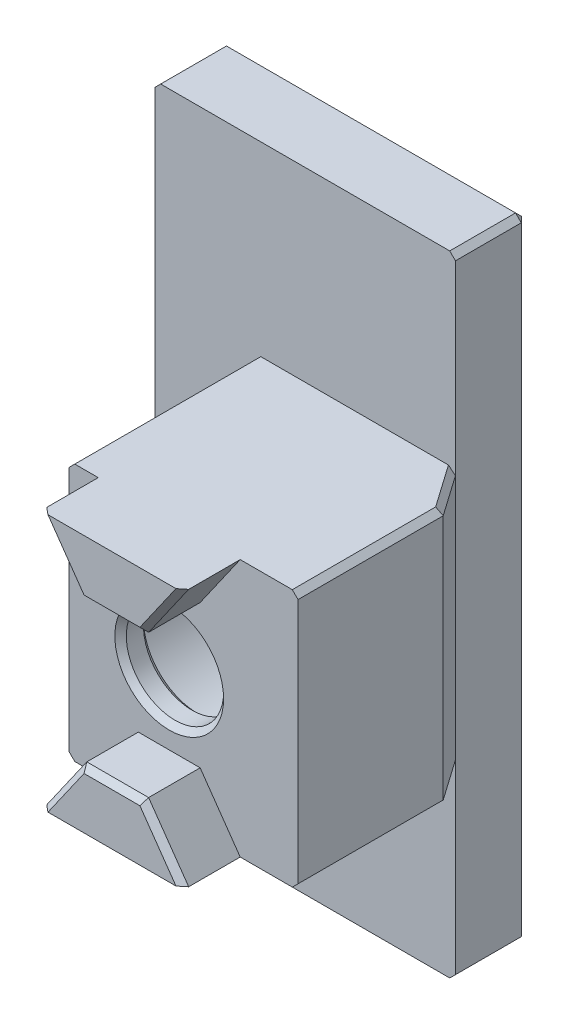
from build123d import *

# Parameters (mm, degrees)
BOSS_EXTRUDE1_DEPTH            = 4
SLOT_TAB_DEPTH                 = 2
CBORE_FOR_M3_SHCS2_D           = 3.4
CBORE_FOR_M3_SHCS2_CBORE_D     = 6.5
CBORE_FOR_M3_SHCS2_CBORE_DEPTH = 3
STOPPER_START                  = 2.5
SKETCH3_W                      = 8
SKETCH3_H                      = 9
SKETCH3_R                      = 3.25
STOPPER_CLEARANCE_DEPTH        = 2.5
SKETCH4_W                      = 10.5
SKETCH4_H                      = 22
SKETCH4_R                      = 3.25
STOPPER_DEPTH                  = 2.5
PRINT_CHAMFER_DEPTH            = 17.560495216
PRINT_CHAMFER_DEPTH_BACK       = 17.560495216
CHAMFER5_SIZE                  = 0.2


with BuildPart() as part:
    # Sketch1 → Boss-Extrude1 (new body)
    with BuildSketch(Plane.XY):
        Polygon((0.5, -4.5), (7.5, -4.5), (8.5, -4.5), (8.5, 4.5), (7.5, 4.5), (0.5, 4.5), align=None)
    extrude(amount=-BOSS_EXTRUDE1_DEPTH)

    # Sketch2 → Slot Tab (add)
    with BuildSketch(Plane.XY):
        Polygon((2.92028223, -2.5), (1.519867154, -4.5), (6.480132846, -4.5), (5.07971777, -2.5), align=None)
    slot_tab = extrude(amount=SLOT_TAB_DEPTH)

    # Slot Tabs: Slot Tab across plane
    add(slot_tab.mirror(Plane.ZX))

    # CBORE for M3 SHCS2 (through all)
    with Locations(Plane(origin=(0, 0, -4), x_dir=(-1, 0, 0), z_dir=(0, 0, -1))):
        with Locations((-4, 0)):
            CounterBoreHole(CBORE_FOR_M3_SHCS2_D / 2, CBORE_FOR_M3_SHCS2_CBORE_D / 2, CBORE_FOR_M3_SHCS2_CBORE_DEPTH)

    # Sketch3 → Stopper Clearance (add)
    with BuildSketch(Plane(origin=(0, 0, -4), x_dir=(-1, 0, 0), z_dir=(0, 0, -1)).offset(STOPPER_START)):
        with Locations((-4.5, 0)):
            Rectangle(SKETCH3_W, SKETCH3_H)
        with Locations((-4, 0)):
            Circle(SKETCH3_R, mode=Mode.SUBTRACT)
    extrude(amount=-STOPPER_CLEARANCE_DEPTH)

    # Sketch4 → Stopper (add)
    with BuildSketch(Plane(origin=(0, 0, -6.5), x_dir=(-1, 0, 0), z_dir=(0, 0, -1)).offset(STOPPER_START)):
        with Locations((-2.25, 0)):
            Rectangle(SKETCH4_W, SKETCH4_H)
        with Locations((-4, 0)):
            Circle(SKETCH4_R, mode=Mode.SUBTRACT)
    extrude(amount=-STOPPER_DEPTH)

    # Deburs With Stopper
    # the kernel refuses this chamfer: 0.2 mm, written as the material it takes off along each edge
    with BuildSketch(Plane(origin=(-2.866666667, -10.866666667, -8.866666667), x_dir=(-0.7071067811865491, 0, 0.707106781186546), z_dir=(-0.5773502691896235, -0.5773502691896274, -0.5773502691896262)), Plane(origin=(-2.866666667, 10.866666667, -8.866666667), x_dir=(1.5700924586837806e-15, 0.7071067811865476, 0.7071067811865476), z_dir=(-0.5773502691896244, 0.5773502691896271, -0.5773502691896257)), Plane(origin=(7.366666667, 10.866666667, -8.866666667), x_dir=(0.7071067811865491, 0, 0.707106781186546), z_dir=(0.5773502691896232, 0.5773502691896284, -0.5773502691896257))) as deburs_with_stopper_piece_1:
        Polygon((-0.141421356, 0.081649658), (0.141421356, 0.081649658), (0, -0.163299316), align=None)
    extrude(amount=0.254034118, mode=Mode.SUBTRACT)
    with BuildSketch(Plane(origin=(7.366666667, -10.866666667, -8.866666667), x_dir=(0.7071067811865491, 0, 0.707106781186546), z_dir=(0.5773502691896241, -0.5773502691896267, -0.5773502691896267))) as deburs_with_stopper_piece_2:
        Polygon((-0.141421356, -0.081649658), (0.141421356, -0.081649658), (0, 0.163299316), align=None)
    extrude(amount=0.254034118, mode=Mode.SUBTRACT)
    with BuildSketch(Plane(origin=(8.5, 4.5, -7.014336598), x_dir=(-0.9996219169112966, 0.02749587661058742, 0), z_dir=(0, 0, 1))) as deburs_with_stopper_piece_3:
        with BuildLine():
            Line((0.205734639, 0), (-0.011309431, 0.205423559))
            Line((-0.011309431, 0.205423559), (-0.015307919, 0.205313575))
            ThreePointArc((-0.015307919, 0.205313575), (-0.006825845, 0.102679566), (-0.003998488, -0.000109984))
            Line((-0.003998488, -0.000109984), (0.000109984, -0.003998488))
            ThreePointArc((0.000109984, -0.003998488), (0.102899533, -0.00117113), (0.205844623, -0.003998488))
            Line((0.205844623, -0.003998488), (0.205734639, 0))
        make_face()
    extrude(amount=7.528673195, mode=Mode.SUBTRACT)
    with BuildSketch(Plane(origin=(8.5, -4.5, -7.014336598), x_dir=(-0.9996219169112966, -0.02749587661058742, 0), z_dir=(0, 0, 1))) as deburs_with_stopper_piece_4:
        with BuildLine():
            Line((0.205734639, 0), (-0.011309431, -0.205423559))
            Line((-0.011309431, -0.205423559), (-0.015307919, -0.205313575))
            ThreePointArc((-0.015307919, -0.205313575), (-0.006825845, -0.102679566), (-0.003998488, 0.000109984))
            Line((-0.003998488, 0.000109984), (0.000109984, 0.003998488))
            ThreePointArc((0.000109984, 0.003998488), (0.102899533, 0.00117113), (0.205844623, 0.003998488))
            Line((0.205844623, 0.003998488), (0.205734639, 0))
        make_face()
    extrude(amount=7.528673195, mode=Mode.SUBTRACT)
    with BuildSketch(Plane(origin=(0.5, -4.5, 0.514336598), x_dir=(0.9996219169112966, -0.02749587661058736, 0), z_dir=(0, 0, -1))) as deburs_with_stopper_piece_5:
        with BuildLine():
            Line((0.205734639, 0), (-0.011309431, -0.205423559))
            Line((-0.011309431, -0.205423559), (-0.015307919, -0.205313575))
            ThreePointArc((-0.015307919, -0.205313575), (-0.006825845, -0.102679566), (-0.003998488, 0.000109984))
            Line((-0.003998488, 0.000109984), (0.000109984, 0.003998488))
            ThreePointArc((0.000109984, 0.003998488), (0.102899533, 0.00117113), (0.205844623, 0.003998488))
            Line((0.205844623, 0.003998488), (0.205734639, 0))
        make_face()
    extrude(amount=7.014336598, mode=Mode.SUBTRACT)
    with BuildSketch(Plane(origin=(0.5, 4.5, 0.514336598), x_dir=(0.9996219169112966, 0.02749587661058733, 0), z_dir=(0, 0, -1))) as deburs_with_stopper_piece_6:
        with BuildLine():
            Line((0.205734639, 0), (-0.011309431, 0.205423559))
            Line((-0.011309431, 0.205423559), (-0.015307919, 0.205313575))
            ThreePointArc((-0.015307919, 0.205313575), (-0.006825845, 0.102679566), (-0.003998488, -0.000109984))
            Line((-0.003998488, -0.000109984), (0.000109984, -0.003998488))
            ThreePointArc((0.000109984, -0.003998488), (0.102899533, -0.00117113), (0.205844623, -0.003998488))
            Line((0.205844623, -0.003998488), (0.205734639, 0))
        make_face()
    extrude(amount=7.014336598, mode=Mode.SUBTRACT)
    with BuildSketch(Plane(origin=(6.775144199, -4.921319875, 2), x_dir=(-0.8188423367539712, -0.5733595768003803, 0.02749587661058727), z_dir=(-0.5735764363510434, 0.8191520442889937, 0)), Plane(origin=(3.215293583, 2.078680125, 2), x_dir=(-0.02252330353507913, -0.015770986920647746, -0.9996219169112968), z_dir=(-0.5735764363510445, 0.8191520442889929, 0))) as deburs_with_stopper_piece_7:
        with BuildLine():
            Line((0.205734639, 0), (-0.011309431, -0.205423559))
            Line((-0.011309431, -0.205423559), (-0.015307919, -0.205313575))
            ThreePointArc((-0.015307919, -0.205313575), (-0.006825845, -0.102679566), (-0.003998488, 0.000109984))
            Line((-0.003998488, 0.000109984), (0.000109984, 0.003998488))
            ThreePointArc((0.000109984, 0.003998488), (0.102899533, 0.00117113), (0.205844623, 0.003998488))
            Line((0.205844623, 0.003998488), (0.205734639, 0))
        make_face()
    extrude(amount=3.470222373, mode=Mode.SUBTRACT)
    with BuildSketch(Plane(origin=(5.594054367, -2.5, 2), x_dir=(0, 0.02749587661058736, -0.9996219169112966), z_dir=(-1, 0, 0)), Plane(origin=(5.594054367, 2.5, 2), x_dir=(0, 0.9996219169112966, 0.027495876610587302), z_dir=(-1, 0, 0))) as deburs_with_stopper_piece_8:
        with BuildLine():
            Line((0.205734639, 0), (-0.011309431, 0.205423559))
            Line((-0.011309431, 0.205423559), (-0.015307919, 0.205313575))
            ThreePointArc((-0.015307919, 0.205313575), (-0.006825845, 0.102679566), (-0.003998488, -0.000109984))
            Line((-0.003998488, -0.000109984), (0.000109984, -0.003998488))
            ThreePointArc((0.000109984, -0.003998488), (0.102899533, -0.00117113), (0.205844623, -0.003998488))
            Line((0.205844623, -0.003998488), (0.205734639, 0))
        make_face()
    extrude(amount=3.188108734, mode=Mode.SUBTRACT)
    with BuildSketch(Plane(origin=(3.215293583, -2.078680125, 2), x_dir=(-0.02252330353507913, 0.015770986920647746, -0.9996219169112968), z_dir=(-0.5735764363510445, -0.8191520442889929, 0)), Plane(origin=(6.775144199, 4.921319875, 2), x_dir=(-0.8188423367539712, 0.5733595768003803, 0.02749587661058727), z_dir=(-0.5735764363510434, -0.8191520442889937, 0))) as deburs_with_stopper_piece_9:
        with BuildLine():
            Line((0.205734639, 0), (-0.011309431, 0.205423559))
            Line((-0.011309431, 0.205423559), (-0.015307919, 0.205313575))
            ThreePointArc((-0.015307919, 0.205313575), (-0.006825845, 0.102679566), (-0.003998488, -0.000109984))
            Line((-0.003998488, -0.000109984), (0.000109984, -0.003998488))
            ThreePointArc((0.000109984, -0.003998488), (0.102899533, -0.00117113), (0.205844623, -0.003998488))
            Line((0.205844623, -0.003998488), (0.205734639, 0))
        make_face()
    extrude(amount=3.470222373, mode=Mode.SUBTRACT)
    with BuildSketch(Plane(origin=(4, 0, 0), x_dir=(1, 0, 0), z_dir=(0, -1, 0))) as deburs_with_stopper_piece_10:
        with BuildLine():
            Line((1.905656854, 0.005656854), (1.694343146, -0.205656854))
            Line((1.694343146, -0.205656854), (1.690343146, -0.205656854))
            ThreePointArc((1.690343146, -0.205656854), (1.696, -0.102828427), (1.696, 0))
            Line((1.696, 0), (1.7, 0.004))
            ThreePointArc((1.7, 0.004), (1.802828427, 0.004), (1.905656854, 0.009656854))
            Line((1.905656854, 0.009656854), (1.905656854, 0.005656854))
        make_face()
    revolve(axis=Axis((4, 0, 0), (0, 0, 1)), mode=Mode.SUBTRACT)
    with BuildSketch(Plane(origin=(4, 0, -1), x_dir=(1, 0, 0), z_dir=(0, -1, 0))) as deburs_with_stopper_piece_11:
        with BuildLine():
            Line((1.694343146, 0.205656854), (1.905656854, -0.005656854))
            Line((1.905656854, -0.005656854), (1.905656854, -0.009656854))
            ThreePointArc((1.905656854, -0.009656854), (1.802828427, -0.004), (1.7, -0.004))
            Line((1.7, -0.004), (1.696, 0))
            ThreePointArc((1.696, 0), (1.696, 0.102828427), (1.690343146, 0.205656854))
            Line((1.690343146, 0.205656854), (1.694343146, 0.205656854))
        make_face()
    revolve(axis=Axis((4, 0, -1), (0, 0, 1)), mode=Mode.SUBTRACT)
    with BuildSketch(Plane(origin=(-3, -11.514336598, -9), x_dir=(0.9996219169112966, 0, -0.027495876610587302), z_dir=(0, 1, 0)), Plane(origin=(7.5, 11.514336598, -9), x_dir=(-0.9996219169112966, 0, -0.02749587661058742), z_dir=(0, -1, 0))) as deburs_with_stopper_piece_12:
        with BuildLine():
            Line((0.205734639, 0), (-0.011309431, -0.205423559))
            Line((-0.011309431, -0.205423559), (-0.015307919, -0.205313575))
            ThreePointArc((-0.015307919, -0.205313575), (-0.006825845, -0.102679566), (-0.003998488, 0.000109984))
            Line((-0.003998488, 0.000109984), (0.000109984, 0.003998488))
            ThreePointArc((0.000109984, 0.003998488), (0.102899533, 0.00117113), (0.205844623, 0.003998488))
            Line((0.205844623, 0.003998488), (0.205734639, 0))
        make_face()
    extrude(amount=23.028673195, mode=Mode.SUBTRACT)
    with BuildSketch(Plane(origin=(-3.514336598, 11, -9), x_dir=(0, -0.9996219169112966, -0.02749587661058742), z_dir=(1, 0, 0)), Plane(origin=(8.014336598, -11, -9), x_dir=(0, 0.9996219169112966, -0.02749587661058742), z_dir=(-1, 0, 0))) as deburs_with_stopper_piece_13:
        with BuildLine():
            Line((0.205734639, 0), (-0.011309431, -0.205423559))
            Line((-0.011309431, -0.205423559), (-0.015307919, -0.205313575))
            ThreePointArc((-0.015307919, -0.205313575), (-0.006825845, -0.102679566), (-0.003998488, 0.000109984))
            Line((-0.003998488, 0.000109984), (0.000109984, 0.003998488))
            ThreePointArc((0.000109984, 0.003998488), (0.102899533, 0.00117113), (0.205844623, 0.003998488))
            Line((0.205844623, 0.003998488), (0.205734639, 0))
        make_face()
    extrude(amount=11.528673195, mode=Mode.SUBTRACT)
    with BuildSketch(Plane(origin=(-3, -11, -9.514336598), x_dir=(-0.02749587661058742, 0.9996219169112966, 0), z_dir=(0, 0, 1)), Plane(origin=(-3, 11, -9.514336598), x_dir=(0.9996219169112966, 0.027495876610587302, 0), z_dir=(0, 0, 1)), Plane(origin=(7.5, 11, -9.514336598), x_dir=(0.02749587661058742, -0.9996219169112966, 0), z_dir=(0, 0, 1))) as deburs_with_stopper_piece_14:
        with BuildLine():
            Line((0.205734639, 0), (-0.011309431, -0.205423559))
            Line((-0.011309431, -0.205423559), (-0.015307919, -0.205313575))
            ThreePointArc((-0.015307919, -0.205313575), (-0.006825845, -0.102679566), (-0.003998488, 0.000109984))
            Line((-0.003998488, 0.000109984), (0.000109984, 0.003998488))
            ThreePointArc((0.000109984, 0.003998488), (0.102899533, 0.00117113), (0.205844623, 0.003998488))
            Line((0.205844623, 0.003998488), (0.205734639, 0))
        make_face()
    extrude(amount=3.528673195, mode=Mode.SUBTRACT)
    with BuildSketch(Plane(origin=(7.5, -11, -9.514336598), x_dir=(0.02749587661058742, 0.9996219169112966, 0), z_dir=(0, 0, 1))) as deburs_with_stopper_piece_15:
        with BuildLine():
            Line((0.205734639, 0), (-0.011309431, 0.205423559))
            Line((-0.011309431, 0.205423559), (-0.015307919, 0.205313575))
            ThreePointArc((-0.015307919, 0.205313575), (-0.006825845, 0.102679566), (-0.003998488, -0.000109984))
            Line((-0.003998488, -0.000109984), (0.000109984, -0.003998488))
            ThreePointArc((0.000109984, -0.003998488), (0.102899533, -0.00117113), (0.205844623, -0.003998488))
            Line((0.205844623, -0.003998488), (0.205734639, 0))
        make_face()
    extrude(amount=3.528673195, mode=Mode.SUBTRACT)
    with BuildSketch(Plane(origin=(4, 0, -9), x_dir=(-1, 0, 0), z_dir=(0, -1, 0))) as deburs_with_stopper_piece_16:
        with BuildLine():
            Line((3.244343146, -0.205656854), (3.455656854, 0.005656854))
            Line((3.455656854, 0.005656854), (3.455656854, 0.009656854))
            ThreePointArc((3.455656854, 0.009656854), (3.352828427, 0.004), (3.25, 0.004))
            Line((3.25, 0.004), (3.246, 0))
            ThreePointArc((3.246, 0), (3.246, -0.102828427), (3.240343146, -0.205656854))
            Line((3.240343146, -0.205656854), (3.244343146, -0.205656854))
        make_face()
    revolve(axis=Axis((4, 0, -9), (0, 0, -1)), mode=Mode.SUBTRACT)

    # Sketch10 → Print Chamfer (cut, two sides: drawn at the far end of the back side and taken through both)
    with BuildSketch(Plane(origin=(0, 0, 0), x_dir=(1, 0, 0), z_dir=(0, 1, 0)).offset(-PRINT_CHAMFER_DEPTH_BACK)):
        Polygon((7.5, 6.5), (8.5, 6.5), (8.5, 5.071851993), align=None)
    extrude(amount=PRINT_CHAMFER_DEPTH + PRINT_CHAMFER_DEPTH_BACK, mode=Mode.SUBTRACT)

    # Chamfer5
    chamfer5_edges = [part.edges().sort_by_distance(p)[0] for p in [
        (7.9, 4.5, -5.928740797),
        (7.9, -4.5, -5.928740797),
    ]]
    chamfer(chamfer5_edges, length=CHAMFER5_SIZE)


solid = part.part
